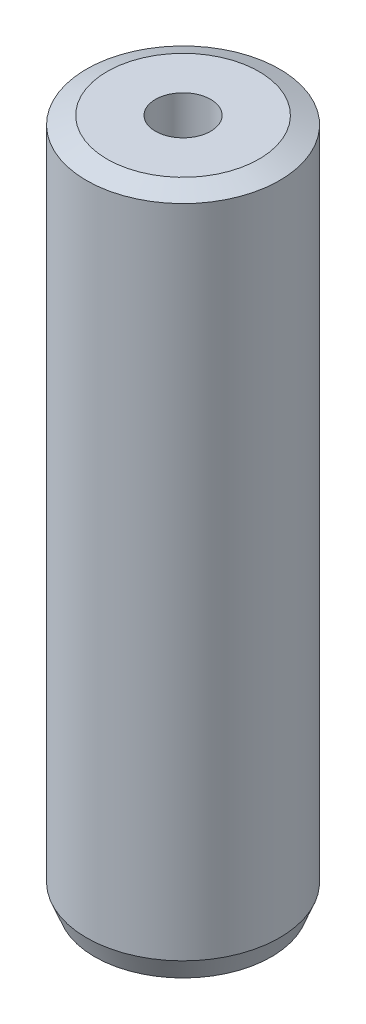
from build123d import *
from OCP.BRepFilletAPI import BRepFilletAPI_MakeChamfer

# Parameters (mm, degrees)
SKETCH1_R           = 22.5
BOSS_EXTRUDE1_DEPTH = 159.526723798
SKETCH2_R           = 6.441072547
CUT_EXTRUDE1_DEPTH  = 163.669221446
CHAMFER1_SIZE       = 1.906962146
CHAMFER1_SIZE2      = 4.802828051


with BuildPart() as part:
    # Sketch1 → Boss-Extrude1 (new body)
    with BuildSketch(Plane(origin=(0, 0, 0), x_dir=(1, 0, 0), z_dir=(0, 1, 0))):
        Circle(SKETCH1_R)
    extrude(amount=BOSS_EXTRUDE1_DEPTH)

    # Sketch2 → Cut-Extrude1 (cut, through all)
    with BuildSketch(Plane(origin=(0, 0, 0), x_dir=(1, 0, 0), z_dir=(0, 1, 0))):
        Circle(SKETCH2_R)
    extrude(amount=CUT_EXTRUDE1_DEPTH, mode=Mode.SUBTRACT)

    # Chamfer1: one chamfer whose edges measure the first distance from different faces: ONE call of the kernel's chamfer builder (chamfer() names one face for all edges)
    chamfer1_edges_1 = [part.edges().sort_by_distance(p)[0] for p in [
        (-22.5, 159.526723798, 0),
    ]]
    chamfer1_side_1 = [part.faces().sort_by_distance(p)[0] for p in [
        (-22.5, 79.763361899, 0),
    ]]
    chamfer1_edges_2 = [part.edges().sort_by_distance(p)[0] for p in [
        (-22.5, 0, 0),
    ]]
    chamfer1_side_2 = [part.faces().sort_by_distance(p)[0] for p in [
        (-21.863603897, 0, 0),
    ]]
    chamfer1 = BRepFilletAPI_MakeChamfer(part.part.solid().wrapped)
    for e in chamfer1_edges_1:
        chamfer1.Add(CHAMFER1_SIZE, CHAMFER1_SIZE2, e.wrapped, chamfer1_side_1[0].wrapped)  # the first distance lies on this face
    for e in chamfer1_edges_2:
        chamfer1.Add(CHAMFER1_SIZE, CHAMFER1_SIZE2, e.wrapped, chamfer1_side_2[0].wrapped)  # the first distance lies on this face
    add(Compound.cast(chamfer1.Shape()), mode=Mode.REPLACE)


solid = part.part
